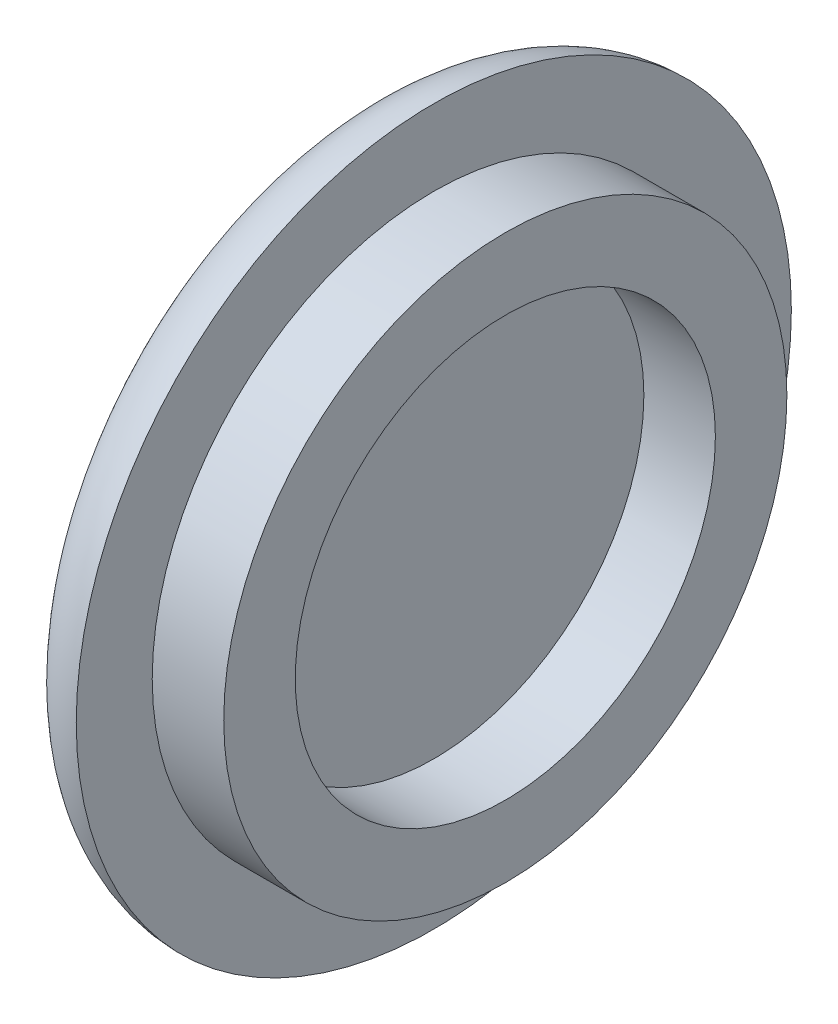
from build123d import *

# Parameters (mm, degrees)
SKETCH1_R           = 7.875
BOSS_EXTRUDE1_DEPTH = 2
SKETCH1_3_R         = 10
BOSS_EXTRUDE2_DEPTH = 2
FILLET1_R           = 2
SKETCH2_R           = 5.875
CUT_EXTRUDE1_DEPTH  = 2


with BuildPart() as part:
    # Sketch1 → Boss-Extrude1 (new body)
    with BuildSketch(Plane(origin=(0, 0, 0), x_dir=(0, 0, -1), z_dir=(1, 0, 0))):
        Circle(SKETCH1_R)
    extrude(amount=BOSS_EXTRUDE1_DEPTH)

    # Sketch1<3> → Boss-Extrude2 (add)
    with BuildSketch(Plane(origin=(0, 0, 0), x_dir=(0, 0, -1), z_dir=(1, 0, 0))):
        Circle(SKETCH1_3_R)
    extrude(amount=-BOSS_EXTRUDE2_DEPTH)

    # Fillet1
    fillet1_edges = [part.edges().sort_by_distance(p)[0] for p in [
        (-2, 0, 10),
    ]]
    fillet(fillet1_edges, radius=FILLET1_R - 0.0001)  # a hair under: the kernel refuses the full size

    # Sketch2 → Cut-Extrude1 (cut)
    with BuildSketch(Plane(origin=(2, 0, 0), x_dir=(0, 0, -1), z_dir=(1, 0, 0))):
        Circle(SKETCH2_R)
    extrude(amount=-CUT_EXTRUDE1_DEPTH, mode=Mode.SUBTRACT)


solid = part.part
